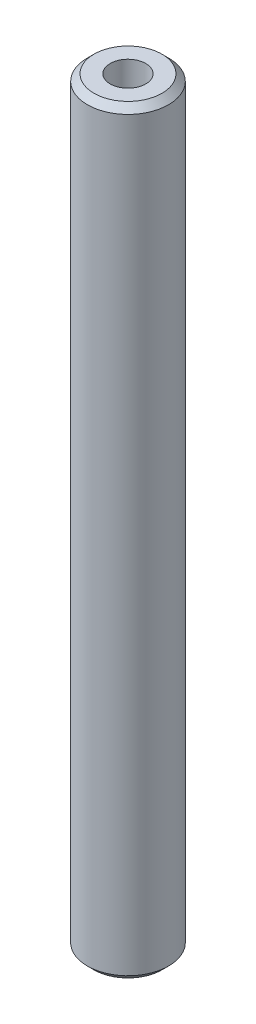
from build123d import *

# Parameters (mm, degrees)
SKETCH1_R           = 7.5
BOSS_EXTRUDE1_DEPTH = 140.394431058
SKETCH2_R           = 3.286571222
CUT_EXTRUDE1_DEPTH  = 141.794517905
CHAMFER1_SIZE       = 1.222027281


with BuildPart() as part:
    # Sketch1 → Boss-Extrude1 (new body)
    with BuildSketch(Plane(origin=(0, 0, 0), x_dir=(1, 0, 0), z_dir=(0, 1, 0))):
        Circle(SKETCH1_R)
    extrude(amount=BOSS_EXTRUDE1_DEPTH)

    # Sketch2 → Cut-Extrude1 (cut, through all)
    with BuildSketch(Plane(origin=(0, 0, 0), x_dir=(1, 0, 0), z_dir=(0, 1, 0))):
        Circle(SKETCH2_R)
    extrude(amount=CUT_EXTRUDE1_DEPTH, mode=Mode.SUBTRACT)

    # Chamfer1
    chamfer1_edges = [part.edges().sort_by_distance(p)[0] for p in [
        (-7.5, 140.394431058, 0),
        (-7.5, 0, 0),
    ]]
    chamfer(chamfer1_edges, length=CHAMFER1_SIZE)


solid = part.part
